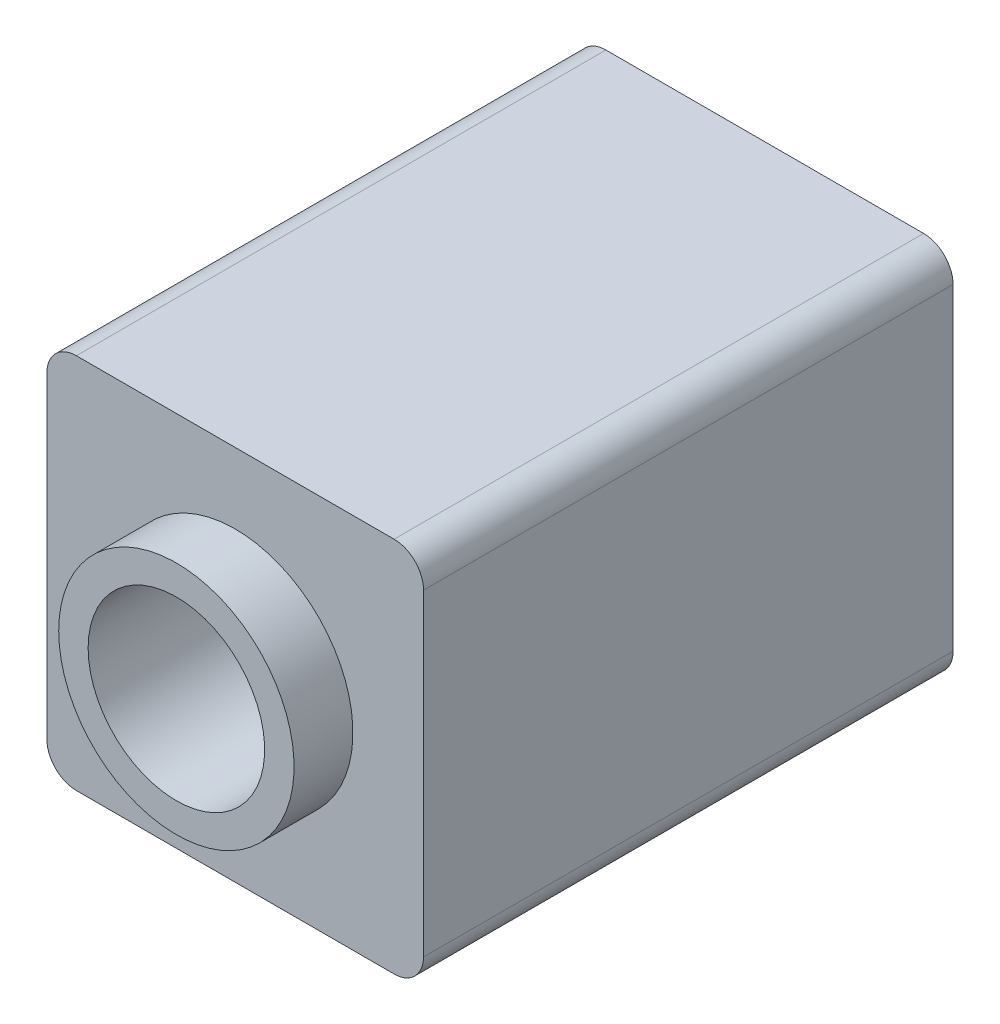
from build123d import *

# Parameters (mm, degrees)
SKETCH2_R           = 1.5
BOSS_EXTRUDE1_DEPTH = 10
SKETCH3_R           = 2
CUT_EXTRUDE1_DEPTH  = 1
SKETCH4_R           = 2.4
CUT_EXTRUDE2_DEPTH  = 4


with BuildPart() as part:
    # Sketch2 → Boss-Extrude1 (new body)
    with BuildSketch(Plane(origin=(0, 0, -57.465471353), x_dir=(-1, 0, 0), z_dir=(0, 0, -1))):
        with BuildLine():
            Line((-6.440457264, -35.028386779), (-1.040457264, -35.028386779))
            ThreePointArc((-1.040457264, -35.028386779), (-0.686903873, -34.881940169), (-0.540457264, -34.528386779))
            Line((-0.540457264, -34.528386779), (-0.540457264, -29.128386779))
            ThreePointArc((-0.540457264, -29.128386779), (-0.686903873, -28.774833388), (-1.040457264, -28.628386779))
            Line((-1.040457264, -28.628386779), (-6.440457264, -28.628386779))
            ThreePointArc((-6.440457264, -28.628386779), (-6.794010654, -28.774833388), (-6.940457264, -29.128386779))
            Line((-6.940457264, -29.128386779), (-6.940457264, -34.528386779))
            ThreePointArc((-6.940457264, -34.528386779), (-6.794010654, -34.881940169), (-6.440457264, -35.028386779))
        make_face()
        with Locations((-3.740457264, -31.828386779)):
            Circle(SKETCH2_R, mode=Mode.SUBTRACT)
    extrude(amount=BOSS_EXTRUDE1_DEPTH)

    # Sketch3 → Cut-Extrude1 (cut)
    with BuildSketch(Plane(origin=(0, 0, -57.465471353), x_dir=(-1, 0, 0), z_dir=(0, 0, -1))):
        with BuildLine():
            Line((-1.040457264, -28.628386779), (-6.440457264, -28.628386779))
            ThreePointArc((-6.440457264, -28.628386779), (-6.794010654, -28.774833388), (-6.940457264, -29.128386779))
            Line((-6.940457264, -29.128386779), (-6.940457264, -34.528386779))
            ThreePointArc((-6.940457264, -34.528386779), (-6.794010654, -34.881940169), (-6.440457264, -35.028386779))
            Line((-6.440457264, -35.028386779), (-1.040457264, -35.028386779))
            ThreePointArc((-1.040457264, -35.028386779), (-0.686903873, -34.881940169), (-0.540457264, -34.528386779))
            Line((-0.540457264, -34.528386779), (-0.540457264, -29.128386779))
            ThreePointArc((-0.540457264, -29.128386779), (-0.686903873, -28.774833388), (-1.040457264, -28.628386779))
        make_face()
        with Locations((-3.740457264, -31.828386779)):
            Circle(SKETCH3_R, mode=Mode.SUBTRACT)
    extrude(amount=CUT_EXTRUDE1_DEPTH, mode=Mode.SUBTRACT)

    # Sketch4 → Cut-Extrude2 (cut)
    with BuildSketch(Plane(origin=(0, 0, -67.465471353), x_dir=(-1, 0, 0), z_dir=(0, 0, -1))):
        with Locations((-3.740457264, -31.828386779)):
            Circle(SKETCH4_R)
    extrude(amount=-CUT_EXTRUDE2_DEPTH, mode=Mode.SUBTRACT)


solid = part.part
